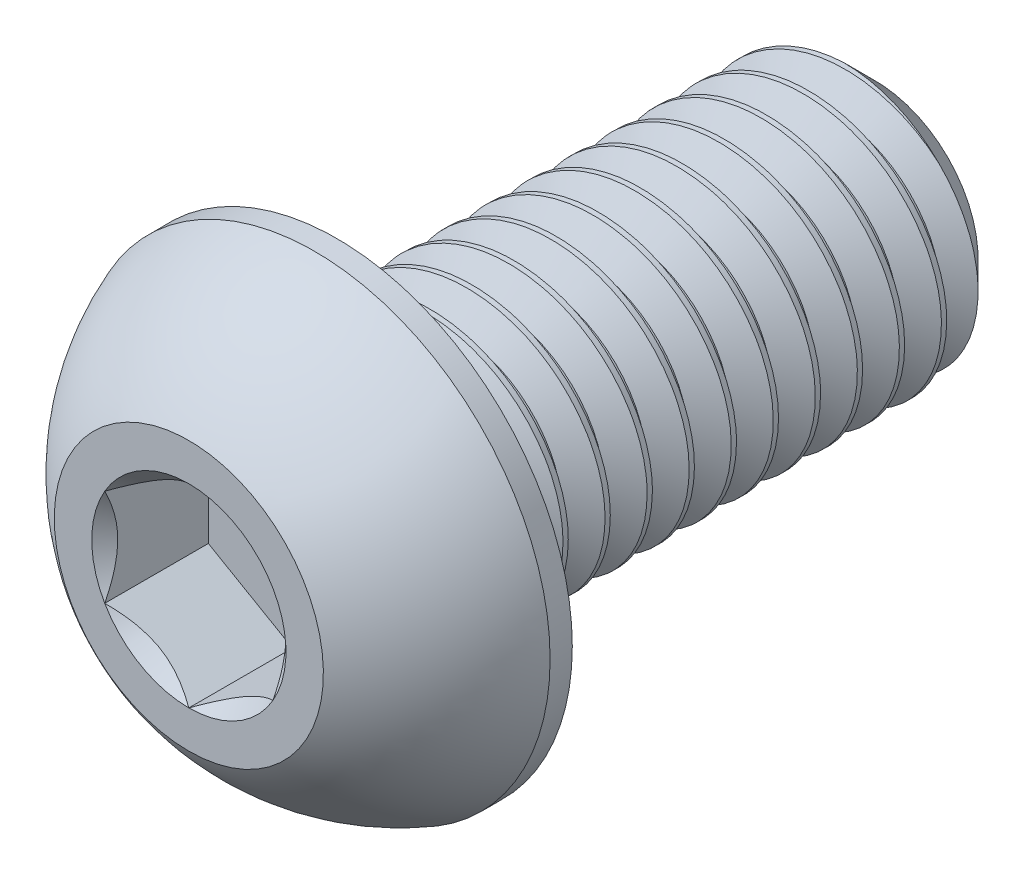
from build123d import *

# Parameters (mm, degrees)
SKETCH1_W          = 16
SKETCH1_H          = 4
CHAMFER1_SIZE      = 0.9375
CUT_EXTRUDE2_DEPTH = 3.08
CUT_SWEEP1_PITCH   = 1.25


with BuildPart() as part:
    # Sketch1 → Revolve1 (revolve)
    with BuildSketch(Plane(origin=(0, 0, 0), x_dir=(0, 0, -1), z_dir=(1, 0, 0)), mode=Mode.PRIVATE) as revolve1_sk:
        with Locations((12.4, 2)):
            Rectangle(SKETCH1_W, SKETCH1_H)
    revolve(revolve1_sk.sketch.rotate(Axis((0, 0, -20.4), (0, 0, 1)), 90), axis=Axis((0, 0, -20.4), (0, 0, 1)))

    # Chamfer1
    chamfer1_edges = [part.edges().sort_by_distance(p)[0] for p in [
        (4, 0, -20.4),
    ]]
    chamfer(chamfer1_edges, length=CHAMFER1_SIZE)

    # Sketch7 → Revolve2 (revolve)
    with BuildSketch(Plane(origin=(0, 0, 0), x_dir=(0, 0, -1), z_dir=(1, 0, 0)), mode=Mode.PRIVATE) as revolve2_sk:
        with BuildLine():
            Line((3.74, 7), (4.4, 7))
            Line((4.4, 7), (4.4, 0))
            Line((4.4, 0), (0, 0))
            Line((0, 0), (0, 4))
            ThreePointArc((0, 4), (1.621972026, 5.809208208), (3.74, 7))
        make_face()
    revolve(revolve2_sk.sketch.rotate(Axis((0, 0, 0), (0, 0, -1)), 180), axis=Axis((0, 0, 0), (0, 0, -1)))

    # Sketch5 → Cut-Extrude2 (cut)
    with BuildSketch(Plane.XY):
        Polygon((2.5, -1.443375673), (2.5, 1.443375673), (0, 2.886751346), (-2.5, 1.443375673), (-2.5, -1.443375673), (0, -2.886751346), align=None)
    extrude(amount=-CUT_EXTRUDE2_DEPTH, mode=Mode.SUBTRACT)

    # Cut-Extrude3 cone 1 section (through the dimple's axis) → Cut-Extrude3 (revolve, cut)
    with BuildSketch(Plane(origin=(0, 0, 0), x_dir=(0, -1, 0), z_dir=(1, 0, 0))):
        Polygon((0, 0), (2.886751346, 0), (0, 2.886751346), align=None)
    revolve(axis=Axis((0, 0, 0), (0, 0, -1)), mode=Mode.SUBTRACT)

    # Cut-Sweep1: the profile of Sketch2 profile screwed along a right-hand helix of 13.8 turns, 8 arcs to a turn; built about Z, then put on its axis
    cut_sweep1_z = Axis((0, 0, 0), (0, 0, 1))
    cut_sweep1_corners = [(4.0003, 0, 0.937673205), (4.0003, 0, -0.156423205), (3.188101184, 0, 0.3125), (3.188101184, 0, 0.46875)]
    with BuildLine(mode=Mode.PRIVATE) as cut_sweep1_profile:
        Line(cut_sweep1_corners[0], cut_sweep1_corners[1])
        Line(cut_sweep1_corners[1], cut_sweep1_corners[2])
        Line(cut_sweep1_corners[2], cut_sweep1_corners[3])
        Line(cut_sweep1_corners[3], cut_sweep1_corners[0])
    cut_sweep1_cap = Face(cut_sweep1_profile.wire())
    cut_sweep1_turn_angles = [0, 22.5, 45, 67.5, 90, 112.5, 135, 157.5, 180, 202.5, 225, 247.5, 270, 292.5, 315, 337.5, 360]
    cut_sweep1_turn_weights = [1, 0.9238795325112867, 1, 0.9238795325112867, 1, 0.9238795325112867, 1, 0.9238795325112867, 1, 0.9238795325112867, 1, 0.9238795325112867, 1, 0.9238795325112867, 1, 0.9238795325112867, 1]
    cut_sweep1_turn_rails = [Edge.make_bspline([Vector(p[0], p[1], 0).rotate(cut_sweep1_z, cut_sweep1_turn_angles[k]) / cut_sweep1_turn_weights[k] + Vector(0, 0, p[2] + CUT_SWEEP1_PITCH * cut_sweep1_turn_angles[k] / 360) for k in range(17)], [0, 0, 0, 1, 1, 2, 2, 3, 3, 4, 4, 5, 5, 6, 6, 7, 7, 8, 8, 8], 2, cut_sweep1_turn_weights) for p in cut_sweep1_corners]
    cut_sweep1_turn_sides = [Face.make_surface_from_curves(cut_sweep1_turn_rails[p[0]], cut_sweep1_turn_rails[p[1]]) for p in [(0, 1), (1, 2), (2, 3), (3, 0)]]
    cut_sweep1_last_angles = [4680, 4702.5, 4725, 4747.5, 4770, 4792.5, 4815, 4837.5, 4860, 4882.5, 4905, 4927.5, 4950, 4959, 4968]
    cut_sweep1_last_weights = [1, 0.9238795325112867, 1, 0.9238795325112867, 1, 0.9238795325112867, 1, 0.9238795325112867, 1, 0.9238795325112867, 1, 0.9238795325112867, 1, 0.9876883405951464, 1]
    cut_sweep1_last_rails = [Edge.make_bspline([Vector(p[0], p[1], 0).rotate(cut_sweep1_z, cut_sweep1_last_angles[k]) / cut_sweep1_last_weights[k] + Vector(0, 0, p[2] + CUT_SWEEP1_PITCH * cut_sweep1_last_angles[k] / 360) for k in range(15)], [0, 0, 0, 1, 1, 2, 2, 3, 3, 4, 4, 5, 5, 6, 6, 7, 7, 7], 2, cut_sweep1_last_weights) for p in cut_sweep1_corners]
    cut_sweep1_last_sides = [Face.make_surface_from_curves(cut_sweep1_last_rails[p[0]], cut_sweep1_last_rails[p[1]]) for p in [(0, 1), (1, 2), (2, 3), (3, 0)]]
    cut_sweep1 = Plane(origin=(0, 0, -20.4), x_dir=(0, 1, 0), z_dir=(0, 0, 1)) * Solid(Shell([*[p.moved(Location((0, 0, CUT_SWEEP1_PITCH * i))) for i in range(13) for p in cut_sweep1_turn_sides], *cut_sweep1_last_sides, cut_sweep1_cap, cut_sweep1_cap.rotate(cut_sweep1_z, 4968).moved(Location((0, 0, CUT_SWEEP1_PITCH * 4968 / 360)))]))
    add(cut_sweep1, mode=Mode.SUBTRACT)


solid = part.part
